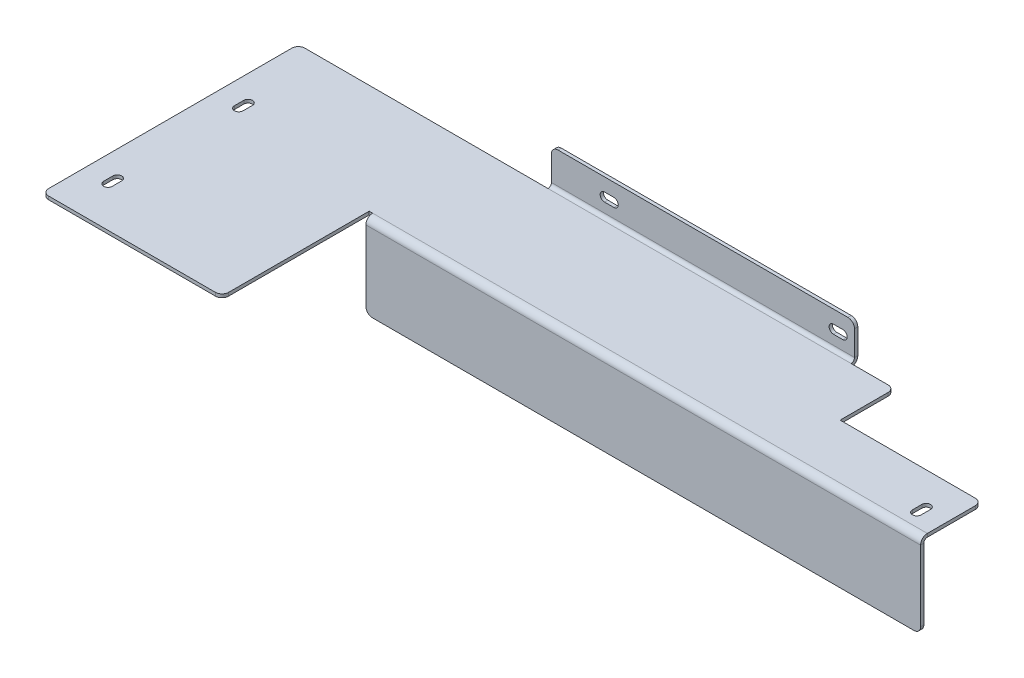
from build123d import *

# Parameters (mm, degrees)
BASE_FLANGE1_DEPTH       = 3.03784
EDGE_FLANGE1_DEPTH       = 278
EDGE_FLANGE2_DEPTH       = 508.825
M6_START                 = -106.21284
M6_CLEARANCE_SLOT1_DEPTH = 3.03784
M6_START_2               = -3.03784
M6_CLEARANCE_SLOT2_DEPTH = 3.03784
FILLET1_R                = 6


# Read off the part's stored shape, not the designer's step: M6 Clearance Slot1, M6 Clearance Slot2
# Sheet-metal steps are written as plain solids
with BuildPart() as part:
    # Sketch1 → Base-Flange1 (new body)
    with BuildSketch(Plane(origin=(0, 0, 0), x_dir=(1, 0, 0), z_dir=(0, 1, 0))):
        Polygon((0, -135), (0, 0), (512, 0), (512, 50), (382, 50), (382, 100), (-165, 100), (-165, -135), align=None)
    extrude(amount=-BASE_FLANGE1_DEPTH)

    # Edge-Flange1 section (across the edge) → Edge-Flange1 (add)
    with BuildSketch(Plane(origin=(342, 0, -103.175), x_dir=(0, 0, 1), z_dir=(-1, 0, 0))):
        with BuildLine():
            Line((-3.03784, 3.175), (-3.03784, 32))
            Line((-3.03784, 32), (0, 32))
            Line((0, 32), (0, 3.175))
            ThreePointArc((0, 3.175), (0.92993597, 0.92993597), (3.175, 0))
            Line((3.175, 0), (3.175, -3.03784))
            ThreePointArc((3.175, -3.03784), (-1.218141294, -1.218141294), (-3.03784, 3.175))
        make_face()
    extrude(amount=EDGE_FLANGE1_DEPTH)

    # Edge-Flange2 section (across the edge) → Edge-Flange2 (add)
    with BuildSketch(Plane(origin=(512, -3.03784, 3.175), x_dir=(0, 0, -1), z_dir=(-1, 0, 0))):
        with BuildLine():
            Line((-3.03784, 3.175), (-3.03784, 74))
            Line((-3.03784, 74), (0, 74))
            Line((0, 74), (0, 3.175))
            ThreePointArc((0, 3.175), (0.92993597, 0.92993597), (3.175, 0))
            Line((3.175, 0), (3.175, -3.03784))
            ThreePointArc((3.175, -3.03784), (-1.218141294, -1.218141294), (-3.03784, 3.175))
        make_face()
    extrude(amount=EDGE_FLANGE2_DEPTH)

    # M6 Clearance Slot1 outline → M6 Clearance Slot1 (cut)
    with BuildSketch(Plane.XY.offset(M6_START)):
        with BuildLine():
            Line((112.7, 12), (121.3, 12))
            ThreePointArc((121.3, 12), (125.3, 16), (121.3, 20))
            Line((121.3, 20), (112.7, 20))
            ThreePointArc((112.7, 20), (108.7, 16), (112.7, 12))
        make_face()
        with BuildLine():
            ThreePointArc((331.3, 12), (335.3, 16), (331.3, 20))
            Line((331.3, 20), (322.7, 20))
            ThreePointArc((322.7, 20), (318.7, 16), (322.7, 12))
            Line((322.7, 12), (331.3, 12))
        make_face()
    extrude(amount=M6_CLEARANCE_SLOT1_DEPTH, mode=Mode.SUBTRACT)

    # M6 Clearance Slot2 outline → M6 Clearance Slot2 (cut)
    with BuildSketch(Plane(origin=(0, 0, 0), x_dir=(1, 0, 0), z_dir=(0, 1, 0)).offset(M6_START_2)):
        with BuildLine():
            Line((-137.57432, -98.08716), (-137.57432, -89.48716))
            ThreePointArc((-137.57432, -89.48716), (-141.57432, -85.48716), (-145.57432, -89.48716))
            Line((-145.57432, -89.48716), (-145.57432, -98.08716))
            ThreePointArc((-145.57432, -98.08716), (-141.57432, -102.08716), (-137.57432, -98.08716))
        make_face()
        with BuildLine():
            ThreePointArc((-137.57432, 30.51284), (-141.57432, 34.51284), (-145.57432, 30.51284))
            Line((-145.57432, 30.51284), (-145.57432, 21.91284))
            ThreePointArc((-145.57432, 21.91284), (-141.57432, 17.91284), (-137.57432, 21.91284))
            Line((-137.57432, 21.91284), (-137.57432, 30.51284))
        make_face()
        with BuildLine():
            Line((494.42568, 11.91284), (494.42568, 20.51284))
            ThreePointArc((494.42568, 20.51284), (490.42568, 24.51284), (486.42568, 20.51284))
            Line((486.42568, 20.51284), (486.42568, 11.91284))
            ThreePointArc((486.42568, 11.91284), (490.42568, 7.91284), (494.42568, 11.91284))
        make_face()
    extrude(amount=M6_CLEARANCE_SLOT2_DEPTH, mode=Mode.SUBTRACT)

    # Fillet1
    fillet1_edges = [part.edges().sort_by_distance(p)[0] for p in [
        (-165, -1.51892, -100),
        (382, -1.51892, -100),
        (512, -1.51892, -50),
        (0, -1.51892, 135),
        (-165, -1.51892, 135),
        (342, 32, -104.69392),
        (64, 32, -104.69392),
        (512, -77.03784, 4.69392),
        (3.175, -77.03784, 4.69392),
    ]]
    fillet(fillet1_edges, radius=FILLET1_R)


solid = part.part
